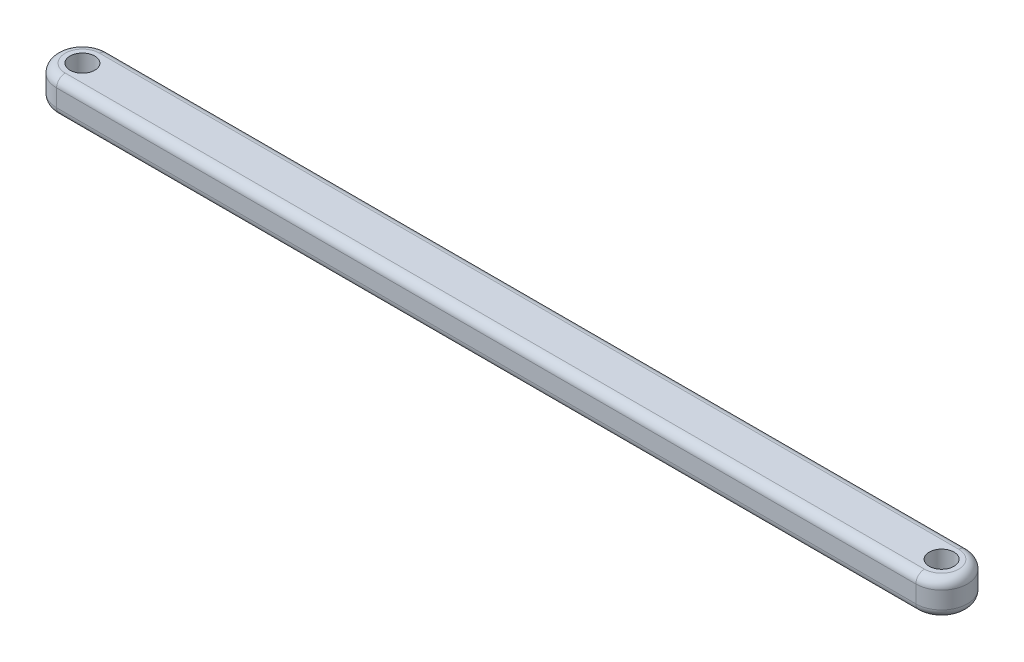
from build123d import *

# Parameters (mm, degrees)
BOSS_EXTRUDE1_DEPTH = 3.175
SKETCH2_R           = 2.286
CUT_EXTRUDE1_DEPTH  = 164.705044402
FILLET1_R           = 1.5875


with BuildPart() as part:
    # Sketch1 → Boss-Extrude1 (new, symmetric)
    with BuildSketch(Plane(origin=(0, 0, 0), x_dir=(1, 0, 0), z_dir=(0, 1, 0))):
        with BuildLine():
            Line((0, 4.7625), (158.75, 4.7625))
            ThreePointArc((158.75, 4.7625), (163.5125, 0), (158.75, -4.7625))
            Line((158.75, -4.7625), (0, -4.7625))
            ThreePointArc((0, -4.7625), (-4.7625, 0), (0, 4.7625))
        make_face()
    extrude(amount=BOSS_EXTRUDE1_DEPTH, both=True)

    # Sketch2 → Cut-Extrude1 (cut, through all)
    with BuildSketch(Plane(origin=(0, 3.175, 0), x_dir=(1, 0, 0), z_dir=(0, 1, 0))):
        Circle(SKETCH2_R)
        with Locations((158.75, 0)):
            Circle(SKETCH2_R)
    extrude(amount=-CUT_EXTRUDE1_DEPTH, mode=Mode.SUBTRACT)

    # Fillet1
    fillet1_edges = [part.edges().sort_by_distance(p)[0] for p in [
        (163.5125, -3.175, 0),
        (79.375, -3.175, 4.7625),
        (-4.7625, -3.175, 0),
        (163.5125, 3.175, 0),
        (79.375, 3.175, 4.7625),
        (-4.7625, 3.175, 0),
        (79.375, -3.175, -4.7625),
        (79.375, 3.175, -4.7625),
    ]]
    fillet(fillet1_edges, radius=FILLET1_R)


solid = part.part
